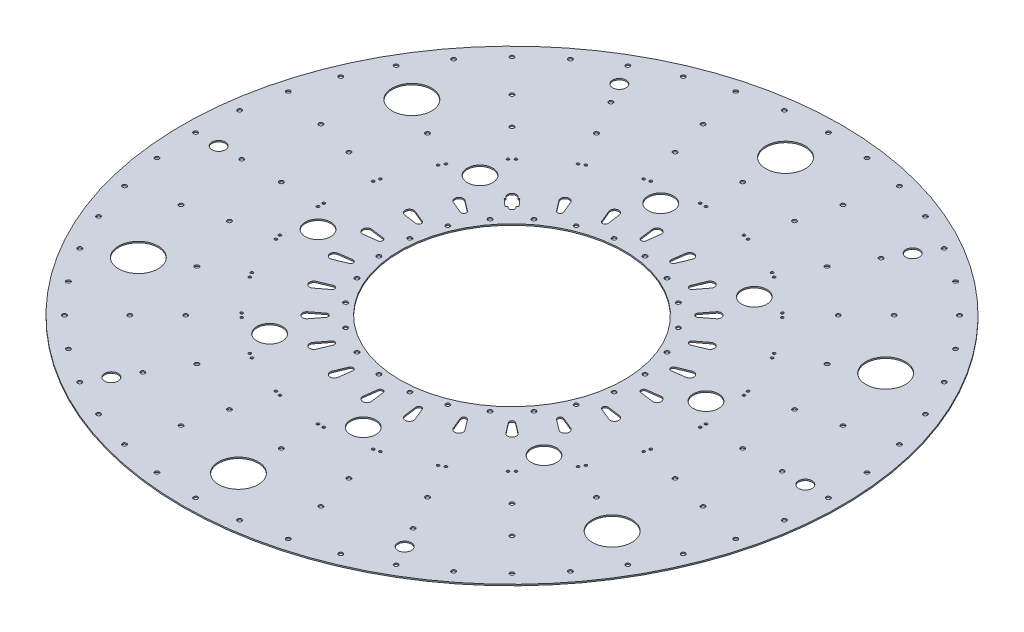
from build123d import *

# Parameters (mm, degrees)
SKETCH2_R               = 250
SKETCH2_R_2             = 1.6
SKETCH2_R_3             = 5.1
SKETCH2_R_4             = 1
SKETCH2_R_5             = 15
SKETCH2_R_6             = 9.61934833
SKETCH2_R_7             = 75.5
BOSS_EXTRUDE1_DEPTH     = 0.5
CUT_EXTRUDE1_DEPTH      = 354.554804804
CUT_EXTRUDE1_DEPTH_BACK = 354.554804804
SKETCH3_R               = 85


with BuildPart() as part:
    # Sketch2 → Boss-Extrude1 (new, symmetric)
    with BuildSketch(Plane(origin=(0, 0, 0), x_dir=(1, 0, 0), z_dir=(0, 1, 0))):
        Circle(SKETCH2_R)
        with Locations((-146.102742962, -190.40480167)):
            Circle(SKETCH2_R_2, mode=Mode.SUBTRACT)
        with Locations((-190.40480167, -146.102742962)):
            Circle(SKETCH2_R_2, mode=Mode.SUBTRACT)
        with Locations((-169.705627485, -169.705627485)):
            Circle(SKETCH2_R_2, mode=Mode.SUBTRACT)
        with Locations((-144.956890143, -144.956890143)):
            Circle(SKETCH2_R_2, mode=Mode.SUBTRACT)
        with Locations((-91.844023768, -221.731087803)):
            Circle(SKETCH2_R_2, mode=Mode.SUBTRACT)
        with Locations((-120, -207.846096908)):
            Circle(SKETCH2_R_2, mode=Mode.SUBTRACT)
        with Locations((-111.25, -192.690652342)):
            Circle(SKETCH2_R_3, mode=Mode.SUBTRACT)
        with Locations((-31.326286133, -237.94676673)):
            Circle(SKETCH2_R_2, mode=Mode.SUBTRACT)
        with Locations((-62.116570825, -231.822198309)):
            Circle(SKETCH2_R_2, mode=Mode.SUBTRACT)
        with Locations((-53.057904246, -198.014794389)):
            Circle(SKETCH2_R_2, mode=Mode.SUBTRACT)
        with Locations((-102.5, -177.535207776)):
            Circle(SKETCH2_R_2, mode=Mode.SUBTRACT)
        with Locations((-87.5, -151.554445662)):
            Circle(SKETCH2_R_2, mode=Mode.SUBTRACT)
        with Locations((-70.610752694, -126.645653712)):
            Circle(SKETCH2_R_4, mode=Mode.SUBTRACT)
        with Locations((-45.293332893, -169.037019601)):
            Circle(SKETCH2_R_2, mode=Mode.SUBTRACT)
        with Locations((-39.622658493, -139.481342602)):
            Circle(SKETCH2_R_4, mode=Mode.SUBTRACT)
        with Locations((-35.42644248, -140.605715293)):
            Circle(SKETCH2_R_4, mode=Mode.SUBTRACT)
        with Locations((-2.172121243, -144.98372974)):
            Circle(SKETCH2_R_4, mode=Mode.SUBTRACT)
        with Locations((-207.846096908, -120)):
            Circle(SKETCH2_R_2, mode=Mode.SUBTRACT)
        with Locations((-221.731087803, -91.844023768)):
            Circle(SKETCH2_R_2, mode=Mode.SUBTRACT)
        with Locations((-179.700271285, -103.75)):
            Circle(SKETCH2_R_5, mode=Mode.SUBTRACT)
        with Locations((-151.554445662, -87.5)):
            Circle(SKETCH2_R_2, mode=Mode.SUBTRACT)
        with Locations((-126.645653712, -70.610752694)):
            Circle(SKETCH2_R_4, mode=Mode.SUBTRACT)
        with Locations((-231.822198309, -62.116570825)):
            Circle(SKETCH2_R_2, mode=Mode.SUBTRACT)
        with Locations((-237.94676673, -31.326286133)):
            Circle(SKETCH2_R_2, mode=Mode.SUBTRACT)
        with Locations((-198.014794389, -53.057904246)):
            Circle(SKETCH2_R_2, mode=Mode.SUBTRACT)
        with Locations((-240, 0)):
            Circle(SKETCH2_R_2, mode=Mode.SUBTRACT)
        with Locations((-205, 0)):
            Circle(SKETCH2_R_2, mode=Mode.SUBTRACT)
        with Locations((-169.037019601, -45.293332893)):
            Circle(SKETCH2_R_2, mode=Mode.SUBTRACT)
        with Locations((-139.481342602, -39.622658493)):
            Circle(SKETCH2_R_4, mode=Mode.SUBTRACT)
        with Locations((-140.605715293, -35.42644248)):
            Circle(SKETCH2_R_4, mode=Mode.SUBTRACT)
        with Locations((-175, 0)):
            Circle(SKETCH2_R_2, mode=Mode.SUBTRACT)
        with Locations((-130.00076606, -17.155084923)):
            Circle(SKETCH2_R_6, mode=Mode.SUBTRACT)
        with Locations((-144.98372974, -2.172121243)):
            Circle(SKETCH2_R_4, mode=Mode.SUBTRACT)
        with Locations((-123.743686708, -123.743686708)):
            Circle(SKETCH2_R_2, mode=Mode.SUBTRACT)
        with Locations((-100.9830568, -104.054900121)):
            Circle(SKETCH2_R_4, mode=Mode.SUBTRACT)
        with Locations((-104.054900121, -100.9830568)):
            Circle(SKETCH2_R_4, mode=Mode.SUBTRACT)
        with Locations((-74.372977046, -124.473532469)):
            Circle(SKETCH2_R_4, mode=Mode.SUBTRACT)
        with Locations((-79.793946359, -104.054900121)):
            Circle(SKETCH2_R_6, mode=Mode.SUBTRACT)
        with Locations((-124.473532469, -74.372977046)):
            Circle(SKETCH2_R_4, mode=Mode.SUBTRACT)
        with BuildLine():
            ThreePointArc((-75.159589802, -79.793946359), (-80.119003507, -80.119003507), (-79.793946359, -75.159589802))
            Line((-79.793946359, -75.159589802), (-71.928285435, -69.124055896))
            ThreePointArc((-71.928285435, -69.124055896), (-69.296549014, -69.296549014), (-69.124055896, -71.928285435))
            Line((-69.124055896, -71.928285435), (-75.159589802, -79.793946359))
        make_face(mode=Mode.SUBTRACT)
        with BuildLine():
            ThreePointArc((-25.193140927, -106.683379516), (-29.32559061, -109.444594117), (-31.523789715, -104.987087286))
            Line((-31.523789715, -104.987087286), (-27.729694489, -95.827331136))
            ThreePointArc((-27.729694489, -95.827331136), (-25.364297334, -94.660846348), (-23.899045701, -96.853750385))
            Line((-23.899045701, -96.853750385), (-25.193140927, -106.683379516))
        make_face(mode=Mode.SUBTRACT)
        with BuildLine():
            ThreePointArc((-51.946395881, -96.527766833), (-56.652690682, -98.125338646), (-57.622300307, -93.250781885))
            Line((-57.622300307, -93.250781885), (-51.586766401, -85.38512096))
            ThreePointArc((-51.586766401, -85.38512096), (-49.000059721, -84.87059301), (-48.152300656, -87.368010683))
            Line((-48.152300656, -87.368010683), (-51.946395881, -96.527766833))
        make_face(mode=Mode.SUBTRACT)
        with Locations((-34.441508913, -83.149157926)):
            Circle(SKETCH2_R_2, mode=Mode.SUBTRACT)
        with Locations((-54.788528611, -71.401800626)):
            Circle(SKETCH2_R_2, mode=Mode.SUBTRACT)
        with Locations((-11.7473573, -89.230037524)):
            Circle(SKETCH2_R_2, mode=Mode.SUBTRACT)
        with BuildLine():
            ThreePointArc((-93.250781885, -57.622300307), (-98.125338646, -56.652690682), (-96.527766833, -51.946395881))
            Line((-96.527766833, -51.946395881), (-87.368010682, -48.152300656))
            ThreePointArc((-87.368010682, -48.152300656), (-84.87059301, -49.000059721), (-85.38512096, -51.586766401))
            Line((-85.38512096, -51.586766401), (-93.250781885, -57.622300307))
        make_face(mode=Mode.SUBTRACT)
        with Locations((-71.401800626, -54.788528611)):
            Circle(SKETCH2_R_2, mode=Mode.SUBTRACT)
        with Locations((-83.149157926, -34.441508913)):
            Circle(SKETCH2_R_2, mode=Mode.SUBTRACT)
        with BuildLine():
            ThreePointArc((-104.987087286, -31.523789715), (-109.444594117, -29.32559061), (-106.683379516, -25.193140927))
            Line((-106.683379516, -25.193140927), (-96.853750385, -23.899045701))
            ThreePointArc((-96.853750385, -23.899045701), (-94.660846348, -25.364297334), (-95.827331136, -27.729694489))
            Line((-95.827331136, -27.729694489), (-104.987087286, -31.523789715))
        make_face(mode=Mode.SUBTRACT)
        with Locations((-89.230037524, -11.7473573)):
            Circle(SKETCH2_R_2, mode=Mode.SUBTRACT)
        with Locations((0, -240)):
            Circle(SKETCH2_R_2, mode=Mode.SUBTRACT)
        with Locations((31.326286133, -237.94676673)):
            Circle(SKETCH2_R_2, mode=Mode.SUBTRACT)
        with Locations((62.116570825, -231.822198309)):
            Circle(SKETCH2_R_2, mode=Mode.SUBTRACT)
        with Locations((0, -207.5)):
            Circle(SKETCH2_R_5, mode=Mode.SUBTRACT)
        with Locations((53.057904246, -198.014794389)):
            Circle(SKETCH2_R_2, mode=Mode.SUBTRACT)
        with Locations((91.844023768, -221.731087803)):
            Circle(SKETCH2_R_2, mode=Mode.SUBTRACT)
        with Locations((120, -207.846096908)):
            Circle(SKETCH2_R_2, mode=Mode.SUBTRACT)
        with Locations((111.25, -192.690652342)):
            Circle(SKETCH2_R_3, mode=Mode.SUBTRACT)
        with Locations((0, -175)):
            Circle(SKETCH2_R_2, mode=Mode.SUBTRACT)
        with Locations((45.293332893, -169.037019601)):
            Circle(SKETCH2_R_2, mode=Mode.SUBTRACT)
        with Locations((2.172121243, -144.98372974)):
            Circle(SKETCH2_R_4, mode=Mode.SUBTRACT)
        with Locations((17.155084923, -130.00076606)):
            Circle(SKETCH2_R_6, mode=Mode.SUBTRACT)
        with Locations((35.42644248, -140.605715293)):
            Circle(SKETCH2_R_4, mode=Mode.SUBTRACT)
        with Locations((39.622658493, -139.481342602)):
            Circle(SKETCH2_R_4, mode=Mode.SUBTRACT)
        with Locations((102.5, -177.535207776)):
            Circle(SKETCH2_R_2, mode=Mode.SUBTRACT)
        with Locations((87.5, -151.554445662)):
            Circle(SKETCH2_R_2, mode=Mode.SUBTRACT)
        with Locations((70.610752694, -126.645653712)):
            Circle(SKETCH2_R_4, mode=Mode.SUBTRACT)
        with Locations((146.102742962, -190.40480167)):
            Circle(SKETCH2_R_2, mode=Mode.SUBTRACT)
        with Locations((169.705627485, -169.705627485)):
            Circle(SKETCH2_R_2, mode=Mode.SUBTRACT)
        with Locations((144.956890143, -144.956890143)):
            Circle(SKETCH2_R_2, mode=Mode.SUBTRACT)
        with Locations((190.40480167, -146.102742962)):
            Circle(SKETCH2_R_2, mode=Mode.SUBTRACT)
        with BuildLine():
            ThreePointArc((3.276984948, -109.568696188), (0, -113.305381364), (-3.276984948, -109.568696188))
            Line((-3.276984948, -109.568696188), (-1.982889723, -99.739067057))
            ThreePointArc((-1.982889723, -99.739067057), (0, -98.000119441), (1.982889723, -99.739067057))
            Line((1.982889723, -99.739067057), (3.276984948, -109.568696188))
        make_face(mode=Mode.SUBTRACT)
        with BuildLine():
            ThreePointArc((31.523789715, -104.987087286), (29.32559061, -109.444594117), (25.193140927, -106.683379516))
            Line((25.193140927, -106.683379516), (23.899045701, -96.853750385))
            ThreePointArc((23.899045701, -96.853750385), (25.364297334, -94.660846348), (27.729694489, -95.827331136))
            Line((27.729694489, -95.827331136), (31.523789715, -104.987087286))
        make_face(mode=Mode.SUBTRACT)
        with Locations((11.7473573, -89.230037524)):
            Circle(SKETCH2_R_2, mode=Mode.SUBTRACT)
        with Locations((34.441508913, -83.149157926)):
            Circle(SKETCH2_R_2, mode=Mode.SUBTRACT)
        with BuildLine():
            ThreePointArc((57.622300307, -93.250781885), (56.652690682, -98.125338646), (51.946395881, -96.527766833))
            Line((51.946395881, -96.527766833), (48.152300656, -87.368010683))
            ThreePointArc((48.152300656, -87.368010683), (49.000059721, -84.87059301), (51.586766401, -85.38512096))
            Line((51.586766401, -85.38512096), (57.622300307, -93.250781885))
        make_face(mode=Mode.SUBTRACT)
        with Locations((54.788528611, -71.401800626)):
            Circle(SKETCH2_R_2, mode=Mode.SUBTRACT)
        with Locations((74.372977046, -124.473532469)):
            Circle(SKETCH2_R_4, mode=Mode.SUBTRACT)
        with Locations((123.743686708, -123.743686708)):
            Circle(SKETCH2_R_2, mode=Mode.SUBTRACT)
        with Locations((100.9830568, -104.054900121)):
            Circle(SKETCH2_R_4, mode=Mode.SUBTRACT)
        with Locations((104.054900121, -100.9830568)):
            Circle(SKETCH2_R_4, mode=Mode.SUBTRACT)
        with BuildLine():
            ThreePointArc((79.793946359, -75.159589802), (80.119003507, -80.119003507), (75.159589802, -79.793946359))
            Line((75.159589802, -79.793946359), (69.124055896, -71.928285435))
            ThreePointArc((69.124055896, -71.928285435), (69.296549014, -69.296549014), (71.928285435, -69.124055896))
            Line((71.928285435, -69.124055896), (79.793946359, -75.159589802))
        make_face(mode=Mode.SUBTRACT)
        with Locations((104.054900121, -79.793946359)):
            Circle(SKETCH2_R_6, mode=Mode.SUBTRACT)
        with Locations((124.473532469, -74.372977046)):
            Circle(SKETCH2_R_4, mode=Mode.SUBTRACT)
        with Locations((71.401800626, -54.788528611)):
            Circle(SKETCH2_R_2, mode=Mode.SUBTRACT)
        with BuildLine():
            ThreePointArc((96.527766833, -51.946395881), (98.125338646, -56.652690682), (93.250781885, -57.622300307))
            Line((93.250781885, -57.622300307), (85.38512096, -51.586766401))
            ThreePointArc((85.38512096, -51.586766401), (84.87059301, -49.000059721), (87.368010683, -48.152300656))
            Line((87.368010683, -48.152300656), (96.527766833, -51.946395881))
        make_face(mode=Mode.SUBTRACT)
        with Locations((83.149157926, -34.441508913)):
            Circle(SKETCH2_R_2, mode=Mode.SUBTRACT)
        with Locations((89.230037524, -11.7473573)):
            Circle(SKETCH2_R_2, mode=Mode.SUBTRACT)
        with BuildLine():
            ThreePointArc((106.683379516, -25.193140927), (109.444594117, -29.32559061), (104.987087286, -31.523789715))
            Line((104.987087286, -31.523789715), (95.827331136, -27.729694489))
            ThreePointArc((95.827331136, -27.729694489), (94.660846348, -25.364297334), (96.853750385, -23.899045701))
            Line((96.853750385, -23.899045701), (106.683379516, -25.193140927))
        make_face(mode=Mode.SUBTRACT)
        with BuildLine():
            ThreePointArc((109.568696188, 3.276984948), (113.305381364, 0), (109.568696188, -3.276984948))
            Line((109.568696188, -3.276984948), (99.739067057, -1.982889723))
            ThreePointArc((99.739067057, -1.982889723), (98.000119441, 0), (99.739067057, 1.982889723))
            Line((99.739067057, 1.982889723), (109.568696188, 3.276984948))
        make_face(mode=Mode.SUBTRACT)
        with Locations((179.700271285, -103.75)):
            Circle(SKETCH2_R_5, mode=Mode.SUBTRACT)
        with Locations((151.554445662, -87.5)):
            Circle(SKETCH2_R_2, mode=Mode.SUBTRACT)
        with Locations((126.645653712, -70.610752694)):
            Circle(SKETCH2_R_4, mode=Mode.SUBTRACT)
        with Locations((207.846096908, -120)):
            Circle(SKETCH2_R_2, mode=Mode.SUBTRACT)
        with Locations((221.731087803, -91.844023768)):
            Circle(SKETCH2_R_2, mode=Mode.SUBTRACT)
        with Locations((139.481342602, -39.622658493)):
            Circle(SKETCH2_R_4, mode=Mode.SUBTRACT)
        with Locations((140.605715293, -35.42644248)):
            Circle(SKETCH2_R_4, mode=Mode.SUBTRACT)
        with Locations((169.037019601, -45.293332893)):
            Circle(SKETCH2_R_2, mode=Mode.SUBTRACT)
        with Locations((144.98372974, -2.172121243)):
            Circle(SKETCH2_R_4, mode=Mode.SUBTRACT)
        with Locations((198.014794389, -53.057904246)):
            Circle(SKETCH2_R_2, mode=Mode.SUBTRACT)
        with Locations((231.822198309, -62.116570825)):
            Circle(SKETCH2_R_2, mode=Mode.SUBTRACT)
        with Locations((237.94676673, -31.326286133)):
            Circle(SKETCH2_R_2, mode=Mode.SUBTRACT)
        with Locations((-222.5, 0)):
            Circle(SKETCH2_R_3, mode=Mode.SUBTRACT)
        with Locations((-237.94676673, 31.326286133)):
            Circle(SKETCH2_R_2, mode=Mode.SUBTRACT)
        with Locations((-231.822198309, 62.116570825)):
            Circle(SKETCH2_R_2, mode=Mode.SUBTRACT)
        with Locations((-198.014794389, 53.057904246)):
            Circle(SKETCH2_R_2, mode=Mode.SUBTRACT)
        with Locations((-144.98372974, 2.172121243)):
            Circle(SKETCH2_R_4, mode=Mode.SUBTRACT)
        with Locations((-169.037019601, 45.293332893)):
            Circle(SKETCH2_R_2, mode=Mode.SUBTRACT)
        with Locations((-140.605715293, 35.42644248)):
            Circle(SKETCH2_R_4, mode=Mode.SUBTRACT)
        with Locations((-139.481342602, 39.622658493)):
            Circle(SKETCH2_R_4, mode=Mode.SUBTRACT)
        with Locations((-221.731087803, 91.844023768)):
            Circle(SKETCH2_R_2, mode=Mode.SUBTRACT)
        with Locations((-207.846096908, 120)):
            Circle(SKETCH2_R_2, mode=Mode.SUBTRACT)
        with Locations((-126.645653712, 70.610752694)):
            Circle(SKETCH2_R_4, mode=Mode.SUBTRACT)
        with Locations((-151.554445662, 87.5)):
            Circle(SKETCH2_R_2, mode=Mode.SUBTRACT)
        with Locations((-179.700271285, 103.75)):
            Circle(SKETCH2_R_5, mode=Mode.SUBTRACT)
        with BuildLine():
            ThreePointArc((-109.568696188, -3.276984948), (-113.305381364, 0), (-109.568696188, 3.276984948))
            Line((-109.568696188, 3.276984948), (-99.739067057, 1.982889723))
            ThreePointArc((-99.739067057, 1.982889723), (-98.000119441, 0), (-99.739067057, -1.982889723))
            Line((-99.739067057, -1.982889723), (-109.568696188, -3.276984948))
        make_face(mode=Mode.SUBTRACT)
        with BuildLine():
            ThreePointArc((-106.683379516, 25.193140927), (-109.444594117, 29.32559061), (-104.987087286, 31.523789715))
            Line((-104.987087286, 31.523789715), (-95.827331136, 27.729694489))
            ThreePointArc((-95.827331136, 27.729694489), (-94.660846348, 25.364297334), (-96.853750385, 23.899045701))
            Line((-96.853750385, 23.899045701), (-106.683379516, 25.193140927))
        make_face(mode=Mode.SUBTRACT)
        with Locations((-89.230037524, 11.7473573)):
            Circle(SKETCH2_R_2, mode=Mode.SUBTRACT)
        with Locations((-83.149157926, 34.441508913)):
            Circle(SKETCH2_R_2, mode=Mode.SUBTRACT)
        with BuildLine():
            ThreePointArc((-96.527766833, 51.946395881), (-98.125338646, 56.652690682), (-93.250781885, 57.622300307))
            Line((-93.250781885, 57.622300307), (-85.38512096, 51.586766401))
            ThreePointArc((-85.38512096, 51.586766401), (-84.87059301, 49.000059721), (-87.368010683, 48.152300656))
            Line((-87.368010683, 48.152300656), (-96.527766833, 51.946395881))
        make_face(mode=Mode.SUBTRACT)
        with Locations((-71.401800626, 54.788528611)):
            Circle(SKETCH2_R_2, mode=Mode.SUBTRACT)
        with Locations((-124.473532469, 74.372977046)):
            Circle(SKETCH2_R_4, mode=Mode.SUBTRACT)
        with Locations((-104.054900121, 79.793946359)):
            Circle(SKETCH2_R_6, mode=Mode.SUBTRACT)
        with BuildLine():
            Line((-74.240434445, 68.847079774), (-79.802661738, 73.87893935))
            ThreePointArc((-79.802661738, 73.87893935), (-79.453218961, 74.254619363), (-79.102007646, 74.628646553))
            Line((-79.102007646, 74.628646553), (-79.793946359, 75.159589802))
            ThreePointArc((-79.793946359, 75.159589802), (-80.119003507, 80.119003507), (-75.159589802, 79.793946359))
            Line((-75.159589802, 79.793946359), (-74.628646553, 79.102007646))
            ThreePointArc((-74.628646553, 79.102007646), (-74.254619363, 79.453218961), (-73.87893935, 79.802661738))
            Line((-73.87893935, 79.802661738), (-68.847079774, 74.240434445))
            ThreePointArc((-68.847079774, 74.240434445), (-69.444503174, 73.681907406), (-70.037395639, 73.118572962))
            Line((-70.037395639, 73.118572962), (-69.124055896, 71.928285435))
            ThreePointArc((-69.124055896, 71.928285435), (-69.296549014, 69.296549014), (-71.928285435, 69.124055896))
            Line((-71.928285435, 69.124055896), (-73.118572962, 70.037395639))
            ThreePointArc((-73.118572962, 70.037395639), (-73.681907406, 69.444503174), (-74.240434445, 68.847079774))
        make_face(mode=Mode.SUBTRACT)
        with Locations((-104.054900121, 100.9830568)):
            Circle(SKETCH2_R_4, mode=Mode.SUBTRACT)
        with Locations((-100.9830568, 104.054900121)):
            Circle(SKETCH2_R_4, mode=Mode.SUBTRACT)
        with Locations((-123.743686708, 123.743686708)):
            Circle(SKETCH2_R_2, mode=Mode.SUBTRACT)
        with Locations((-74.372977046, 124.473532469)):
            Circle(SKETCH2_R_4, mode=Mode.SUBTRACT)
        with Locations((-54.788528611, 71.401800626)):
            Circle(SKETCH2_R_2, mode=Mode.SUBTRACT)
        with BuildLine():
            ThreePointArc((-57.622300307, 93.250781885), (-56.652690682, 98.125338646), (-51.946395881, 96.527766833))
            Line((-51.946395881, 96.527766833), (-48.152300656, 87.368010683))
            ThreePointArc((-48.152300656, 87.368010683), (-49.000059721, 84.87059301), (-51.586766401, 85.38512096))
            Line((-51.586766401, 85.38512096), (-57.622300307, 93.250781885))
        make_face(mode=Mode.SUBTRACT)
        with Locations((-34.441508913, 83.149157926)):
            Circle(SKETCH2_R_2, mode=Mode.SUBTRACT)
        with Locations((-11.7473573, 89.230037524)):
            Circle(SKETCH2_R_2, mode=Mode.SUBTRACT)
        with BuildLine():
            ThreePointArc((-31.523789715, 104.987087286), (-29.32559061, 109.444594117), (-25.193140927, 106.683379516))
            Line((-25.193140927, 106.683379516), (-23.899045701, 96.853750385))
            ThreePointArc((-23.899045701, 96.853750385), (-25.364297334, 94.660846348), (-27.729694489, 95.827331136))
            Line((-27.729694489, 95.827331136), (-31.523789715, 104.987087286))
        make_face(mode=Mode.SUBTRACT)
        with Locations((-190.40480167, 146.102742962)):
            Circle(SKETCH2_R_2, mode=Mode.SUBTRACT)
        with Locations((-144.956890143, 144.956890143)):
            Circle(SKETCH2_R_2, mode=Mode.SUBTRACT)
        with Locations((-169.705627485, 169.705627485)):
            Circle(SKETCH2_R_2, mode=Mode.SUBTRACT)
        with Locations((-146.102742962, 190.40480167)):
            Circle(SKETCH2_R_2, mode=Mode.SUBTRACT)
        with Locations((-70.610752694, 126.645653712)):
            Circle(SKETCH2_R_4, mode=Mode.SUBTRACT)
        with Locations((-87.5, 151.554445662)):
            Circle(SKETCH2_R_2, mode=Mode.SUBTRACT)
        with Locations((-102.5, 177.535207776)):
            Circle(SKETCH2_R_2, mode=Mode.SUBTRACT)
        with Locations((-39.622658493, 139.481342602)):
            Circle(SKETCH2_R_4, mode=Mode.SUBTRACT)
        with Locations((-35.42644248, 140.605715293)):
            Circle(SKETCH2_R_4, mode=Mode.SUBTRACT)
        with Locations((-17.155084923, 130.00076606)):
            Circle(SKETCH2_R_6, mode=Mode.SUBTRACT)
        with Locations((-2.172121243, 144.98372974)):
            Circle(SKETCH2_R_4, mode=Mode.SUBTRACT)
        with Locations((-45.293332893, 169.037019601)):
            Circle(SKETCH2_R_2, mode=Mode.SUBTRACT)
        with Locations((-111.25, 192.690652342)):
            Circle(SKETCH2_R_3, mode=Mode.SUBTRACT)
        with Locations((-120, 207.846096908)):
            Circle(SKETCH2_R_2, mode=Mode.SUBTRACT)
        with Locations((-91.844023768, 221.731087803)):
            Circle(SKETCH2_R_2, mode=Mode.SUBTRACT)
        with Locations((-53.057904246, 198.014794389)):
            Circle(SKETCH2_R_2, mode=Mode.SUBTRACT)
        with Locations((-62.116570825, 231.822198309)):
            Circle(SKETCH2_R_2, mode=Mode.SUBTRACT)
        with Locations((-31.326286133, 237.94676673)):
            Circle(SKETCH2_R_2, mode=Mode.SUBTRACT)
        Circle(SKETCH2_R_7, mode=Mode.SUBTRACT)
        with Locations((89.230037524, 11.7473573)):
            Circle(SKETCH2_R_2, mode=Mode.SUBTRACT)
        with BuildLine():
            ThreePointArc((104.987087286, 31.523789715), (109.444594117, 29.32559061), (106.683379516, 25.193140927))
            Line((106.683379516, 25.193140927), (96.853750385, 23.899045701))
            ThreePointArc((96.853750385, 23.899045701), (94.660846348, 25.364297334), (95.827331136, 27.729694489))
            Line((95.827331136, 27.729694489), (104.987087286, 31.523789715))
        make_face(mode=Mode.SUBTRACT)
        with Locations((83.149157926, 34.441508913)):
            Circle(SKETCH2_R_2, mode=Mode.SUBTRACT)
        with Locations((71.401800626, 54.788528611)):
            Circle(SKETCH2_R_2, mode=Mode.SUBTRACT)
        with BuildLine():
            ThreePointArc((93.250781885, 57.622300307), (98.125338646, 56.652690682), (96.527766833, 51.946395881))
            Line((96.527766833, 51.946395881), (87.368010683, 48.152300656))
            ThreePointArc((87.368010683, 48.152300656), (84.87059301, 49.000059721), (85.38512096, 51.586766401))
            Line((85.38512096, 51.586766401), (93.250781885, 57.622300307))
        make_face(mode=Mode.SUBTRACT)
        with Locations((11.7473573, 89.230037524)):
            Circle(SKETCH2_R_2, mode=Mode.SUBTRACT)
        with Locations((54.788528611, 71.401800626)):
            Circle(SKETCH2_R_2, mode=Mode.SUBTRACT)
        with Locations((34.441508913, 83.149157926)):
            Circle(SKETCH2_R_2, mode=Mode.SUBTRACT)
        with BuildLine():
            ThreePointArc((51.946395881, 96.527766833), (56.652690682, 98.125338646), (57.622300307, 93.250781885))
            Line((57.622300307, 93.250781885), (51.586766401, 85.38512096))
            ThreePointArc((51.586766401, 85.38512096), (49.000059721, 84.87059301), (48.152300656, 87.368010683))
            Line((48.152300656, 87.368010683), (51.946395881, 96.527766833))
        make_face(mode=Mode.SUBTRACT)
        with BuildLine():
            ThreePointArc((-3.276984948, 109.568696188), (0, 113.305381364), (3.276984948, 109.568696188))
            Line((3.276984948, 109.568696188), (1.982889723, 99.739067057))
            ThreePointArc((1.982889723, 99.739067057), (0, 98.000119441), (-1.982889723, 99.739067057))
            Line((-1.982889723, 99.739067057), (-3.276984948, 109.568696188))
        make_face(mode=Mode.SUBTRACT)
        with BuildLine():
            ThreePointArc((25.193140927, 106.683379516), (29.32559061, 109.444594117), (31.523789715, 104.987087286))
            Line((31.523789715, 104.987087286), (27.729694489, 95.827331136))
            ThreePointArc((27.729694489, 95.827331136), (25.364297334, 94.660846348), (23.899045701, 96.853750385))
            Line((23.899045701, 96.853750385), (25.193140927, 106.683379516))
        make_face(mode=Mode.SUBTRACT)
        with BuildLine():
            ThreePointArc((75.159589802, 79.793946359), (80.119003507, 80.119003507), (79.793946359, 75.159589802))
            Line((79.793946359, 75.159589802), (71.928285435, 69.124055896))
            ThreePointArc((71.928285435, 69.124055896), (69.296549014, 69.296549014), (69.124055896, 71.928285435))
            Line((69.124055896, 71.928285435), (75.159589802, 79.793946359))
        make_face(mode=Mode.SUBTRACT)
        with Locations((124.473532469, 74.372977046)):
            Circle(SKETCH2_R_4, mode=Mode.SUBTRACT)
        with Locations((79.793946359, 104.054900121)):
            Circle(SKETCH2_R_6, mode=Mode.SUBTRACT)
        with Locations((74.372977046, 124.473532469)):
            Circle(SKETCH2_R_4, mode=Mode.SUBTRACT)
        with Locations((104.054900121, 100.9830568)):
            Circle(SKETCH2_R_4, mode=Mode.SUBTRACT)
        with Locations((100.9830568, 104.054900121)):
            Circle(SKETCH2_R_4, mode=Mode.SUBTRACT)
        with Locations((123.743686708, 123.743686708)):
            Circle(SKETCH2_R_2, mode=Mode.SUBTRACT)
        with Locations((144.98372974, 2.172121243)):
            Circle(SKETCH2_R_4, mode=Mode.SUBTRACT)
        with Locations((130.00076606, 17.155084923)):
            Circle(SKETCH2_R_6, mode=Mode.SUBTRACT)
        with Locations((175, 0)):
            Circle(SKETCH2_R_2, mode=Mode.SUBTRACT)
        with Locations((140.605715293, 35.42644248)):
            Circle(SKETCH2_R_4, mode=Mode.SUBTRACT)
        with Locations((139.481342602, 39.622658493)):
            Circle(SKETCH2_R_4, mode=Mode.SUBTRACT)
        with Locations((169.037019601, 45.293332893)):
            Circle(SKETCH2_R_2, mode=Mode.SUBTRACT)
        with Locations((205, 0)):
            Circle(SKETCH2_R_2, mode=Mode.SUBTRACT)
        with Locations((222.5, 0)):
            Circle(SKETCH2_R_3, mode=Mode.SUBTRACT)
        with Locations((240, 0)):
            Circle(SKETCH2_R_2, mode=Mode.SUBTRACT)
        with Locations((198.014794389, 53.057904246)):
            Circle(SKETCH2_R_2, mode=Mode.SUBTRACT)
        with Locations((237.94676673, 31.326286133)):
            Circle(SKETCH2_R_2, mode=Mode.SUBTRACT)
        with Locations((231.822198309, 62.116570825)):
            Circle(SKETCH2_R_2, mode=Mode.SUBTRACT)
        with Locations((126.645653712, 70.610752694)):
            Circle(SKETCH2_R_4, mode=Mode.SUBTRACT)
        with Locations((151.554445662, 87.5)):
            Circle(SKETCH2_R_2, mode=Mode.SUBTRACT)
        with Locations((179.700271285, 103.75)):
            Circle(SKETCH2_R_5, mode=Mode.SUBTRACT)
        with Locations((221.731087803, 91.844023768)):
            Circle(SKETCH2_R_2, mode=Mode.SUBTRACT)
        with Locations((207.846096908, 120)):
            Circle(SKETCH2_R_2, mode=Mode.SUBTRACT)
        with Locations((2.172121243, 144.98372974)):
            Circle(SKETCH2_R_4, mode=Mode.SUBTRACT)
        with Locations((35.42644248, 140.605715293)):
            Circle(SKETCH2_R_4, mode=Mode.SUBTRACT)
        with Locations((39.622658493, 139.481342602)):
            Circle(SKETCH2_R_4, mode=Mode.SUBTRACT)
        with Locations((0, 175)):
            Circle(SKETCH2_R_2, mode=Mode.SUBTRACT)
        with Locations((45.293332893, 169.037019601)):
            Circle(SKETCH2_R_2, mode=Mode.SUBTRACT)
        with Locations((70.610752694, 126.645653712)):
            Circle(SKETCH2_R_4, mode=Mode.SUBTRACT)
        with Locations((87.5, 151.554445662)):
            Circle(SKETCH2_R_2, mode=Mode.SUBTRACT)
        with Locations((102.5, 177.535207776)):
            Circle(SKETCH2_R_2, mode=Mode.SUBTRACT)
        with Locations((0, 207.5)):
            Circle(SKETCH2_R_5, mode=Mode.SUBTRACT)
        with Locations((53.057904246, 198.014794389)):
            Circle(SKETCH2_R_2, mode=Mode.SUBTRACT)
        with Locations((0, 240)):
            Circle(SKETCH2_R_2, mode=Mode.SUBTRACT)
        with Locations((62.116570825, 231.822198309)):
            Circle(SKETCH2_R_2, mode=Mode.SUBTRACT)
        with Locations((31.326286133, 237.94676673)):
            Circle(SKETCH2_R_2, mode=Mode.SUBTRACT)
        with Locations((111.25, 192.690652342)):
            Circle(SKETCH2_R_3, mode=Mode.SUBTRACT)
        with Locations((120, 207.846096908)):
            Circle(SKETCH2_R_2, mode=Mode.SUBTRACT)
        with Locations((91.844023768, 221.731087803)):
            Circle(SKETCH2_R_2, mode=Mode.SUBTRACT)
        with Locations((144.956890143, 144.956890143)):
            Circle(SKETCH2_R_2, mode=Mode.SUBTRACT)
        with Locations((169.705627485, 169.705627485)):
            Circle(SKETCH2_R_2, mode=Mode.SUBTRACT)
        with Locations((190.40480167, 146.102742962)):
            Circle(SKETCH2_R_2, mode=Mode.SUBTRACT)
        with Locations((146.102742962, 190.40480167)):
            Circle(SKETCH2_R_2, mode=Mode.SUBTRACT)
    extrude(amount=BOSS_EXTRUDE1_DEPTH, both=True)

    # Sketch3 → Cut-Extrude1 (cut, two sides: drawn at the far end of the back side and taken through both)
    with BuildSketch(Plane(origin=(0, 0.5, 0), x_dir=(1, 0, 0), z_dir=(0, 1, 0)).offset(-CUT_EXTRUDE1_DEPTH_BACK)):
        Circle(SKETCH3_R)
    extrude(amount=CUT_EXTRUDE1_DEPTH + CUT_EXTRUDE1_DEPTH_BACK, mode=Mode.SUBTRACT)


solid = part.part
